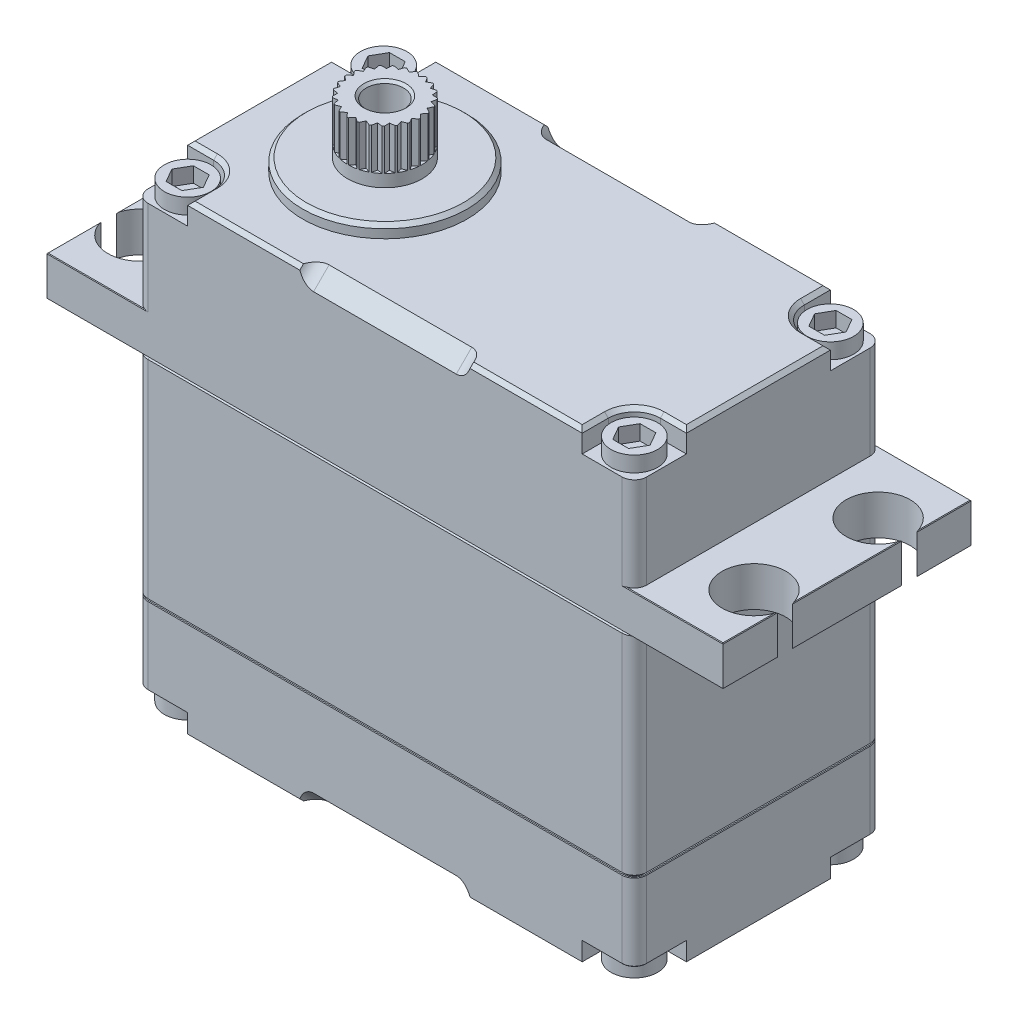
from build123d import *

# Parameters (mm, degrees)
SKETCH1_W              = 40.2
SKETCH1_H              = 20
BOSS_EXTRUDE1_DEPTH    = 9.3
SKETCH2_W              = 54.5
SKETCH2_H              = 20
BOSS_EXTRUDE2_DEPTH    = 3.2
SKETCH3_W              = 40.2
SKETCH3_H              = 20
BOSS_EXTRUDE3_DEPTH    = 17
SKETCH4_W              = 40.2
SKETCH4_H              = 20
BOSS_EXTRUDE5_DEPTH    = 8
SKETCH5_R              = 6.625
BOSS_EXTRUDE6_DEPTH    = 1
SKETCH6_R              = 3
BOSS_EXTRUDE7_DEPTH    = 4.3
SKETCH7_R              = 2.575
CUT_EXTRUDE1_DEPTH     = 3.2
SKETCH9_R              = 1.5
CUT_EXTRUDE3_DEPTH     = 4
CHAMFER1_SIZE          = 0.2
BOSS_EXTRUDE8_START    = -40.2
SKETCH10_W             = 6
SKETCH10_H             = 3
BOSS_EXTRUDE8_DEPTH    = 5
CUT_EXTRUDE2_DEPTH     = 3.3
CUT_EXTRUDE4_DEPTH     = 1.75
CUT_EXTRUDE6_START     = -1.75
CUT_EXTRUDE6_DEPTH     = 1.75
SKETCH12_W             = 14
SKETCH12_H             = 1.25
CUT_EXTRUDE5_DEPTH     = 1.25
SKETCH14_W             = 14
SKETCH14_H             = 1.25
CUT_EXTRUDE7_DEPTH     = 1.25
CHAMFER2_SIZE          = 1.25
CHAMFER3_SIZE          = 1.25
FILLET1_R              = 1.25
CHAMFER5_SIZE          = 0.3
FILLET2_R              = 1.25
CHAMFER6_SIZE          = 0.3
FILLET3_R              = 1
FILLET4_R              = 1
FILLET5_R              = 1
SKETCH15_R             = 1.875
BOSS_EXTRUDE10_DEPTH   = 1.25
BOSS_EXTRUDE10_2_DEPTH = 1.25
BOSS_EXTRUDE10_3_DEPTH = 1.25
BOSS_EXTRUDE10_4_DEPTH = 1.25
SKETCH16_R             = 1.875
BOSS_EXTRUDE12_DEPTH   = 1.25
BOSS_EXTRUDE12_2_DEPTH = 1.25
BOSS_EXTRUDE12_3_DEPTH = 1.25
BOSS_EXTRUDE12_4_DEPTH = 1.25
CHAMFER8_SIZE          = 0.15
CUT_EXTRUDE8_DEPTH     = 1.22
CUT_EXTRUDE9_DEPTH     = 1.22
CHAMFER9_SIZE          = 0.05
CHAMFER10_SIZE         = 0.05


# Some blends are built 0.0001 mm under size
with BuildPart() as part:
    # Sketch1 → Boss-Extrude1 (new body)
    with BuildSketch(Plane(origin=(0, 0, 0), x_dir=(1, 0, 0), z_dir=(0, 1, 0))):
        with Locations((20.1, 10)):
            Rectangle(SKETCH1_W, SKETCH1_H)
    extrude(amount=BOSS_EXTRUDE1_DEPTH)

    # Sketch2 → Boss-Extrude2 (add)
    with BuildSketch(Plane.XZ):
        with Locations((20.1, -10)):
            Rectangle(SKETCH2_W, SKETCH2_H)
    extrude(amount=BOSS_EXTRUDE2_DEPTH)

    # Sketch5 → Boss-Extrude6 (add)
    with BuildSketch(Plane(origin=(0, 9.3, 0), x_dir=(1, 0, 0), z_dir=(0, 1, 0))):
        with Locations(Location((10.1, 10, 0), (0, 0, 90))):
            Circle(SKETCH5_R)
    extrude(amount=BOSS_EXTRUDE6_DEPTH)

    # Sketch7 → Cut-Extrude1 (cut)
    with BuildSketch(Plane(origin=(0, 0, 0), x_dir=(1, 0, 0), z_dir=(0, 1, 0))):
        with Locations((-4.65, 5)):
            Circle(SKETCH7_R)
        with Locations((-4.65, 15)):
            Circle(SKETCH7_R)
        with Locations((44.85, 15)):
            Circle(SKETCH7_R)
        with Locations((44.85, 5)):
            Circle(SKETCH7_R)
    extrude(amount=-CUT_EXTRUDE1_DEPTH, mode=Mode.SUBTRACT)

    # Sketch11 → Cut-Extrude4 (cut)
    with BuildSketch(Plane(origin=(0, 9.3, 0), x_dir=(1, 0, 0), z_dir=(0, 1, 0))):
        with BuildLine():
            Line((36, 2.1), (36, 0))
            Line((36, 0), (40.2, 0))
            Line((40.2, 0), (40.2, 4.2))
            Line((40.2, 4.2), (38.1, 4.2))
            ThreePointArc((38.1, 4.2), (36.61507576, 3.58492424), (36, 2.1))
        make_face()
        with BuildLine():
            Line((38.1, 15.8), (40.2, 15.8))
            Line((40.2, 15.8), (40.2, 20))
            Line((40.2, 20), (36, 20))
            Line((36, 20), (36, 17.9))
            ThreePointArc((36, 17.9), (36.61507576, 16.41507576), (38.1, 15.8))
        make_face()
        with BuildLine():
            Line((2.1, 4.2), (0, 4.2))
            Line((0, 4.2), (0, 0))
            Line((0, 0), (4.2, 0))
            Line((4.2, 0), (4.2, 2.1))
            ThreePointArc((4.2, 2.1), (3.58492424, 3.58492424), (2.1, 4.2))
        make_face()
        with BuildLine():
            Line((4.2, 17.9), (4.2, 20))
            Line((4.2, 20), (0, 20))
            Line((0, 20), (0, 15.8))
            Line((0, 15.8), (2.1, 15.8))
            ThreePointArc((2.1, 15.8), (3.58492424, 16.41507576), (4.2, 17.9))
        make_face()
    extrude(amount=-CUT_EXTRUDE4_DEPTH, mode=Mode.SUBTRACT)

    # Sketch12 → Cut-Extrude5 (cut)
    with BuildSketch(Plane(origin=(0, 9.3, 0), x_dir=(1, 0, 0), z_dir=(0, 1, 0))):
        with Locations((20.1, 19.375)):
            Rectangle(SKETCH12_W, SKETCH12_H)
        with Locations((20.1, 0.625)):
            Rectangle(SKETCH12_W, SKETCH12_H)
    extrude(amount=-CUT_EXTRUDE5_DEPTH, mode=Mode.SUBTRACT)

    # Chamfer2
    chamfer2_edges = [part.edges().sort_by_distance(p)[0] for p in [
        (20.1, 8.05, -1.25),
        (20.1, 8.05, -18.75),
    ]]
    chamfer(chamfer2_edges, length=CHAMFER2_SIZE - 0.0001)  # a hair under: the kernel refuses the full size

    # Fillet1
    # the kernel refuses this fillet: 1.25 mm, written as the material it adds along each edge
    with BuildSketch(Plane(origin=(13.1, 5.840291309, 2.209608691), x_dir=(0, 0.7071067811865475, 0.7071067811865477), z_dir=(0, 0.7071067811865476, -0.7071067811865475))) as fillet1_piece_1_section:
        with BuildLine():
            CenterArc((FILLET1_R, FILLET1_R), FILLET1_R, 180, 90)
            Line((0, FILLET1_R), (-FILLET1_R * 0.02, FILLET1_R))
            Line((-FILLET1_R * 0.02, FILLET1_R), (-FILLET1_R * 0.02, -FILLET1_R * 0.02))
            Line((-FILLET1_R * 0.02, -FILLET1_R * 0.02), (FILLET1_R, -FILLET1_R * 0.02))
            Line((FILLET1_R, -FILLET1_R * 0.02), (FILLET1_R, 0))
        make_face()
    fillet1_piece_1 = extrude(amount=8.017625532, mode=Mode.PRIVATE)
    fillet1_piece_1 = split(fillet1_piece_1, bisect_by=Plane(origin=(13.1, 9.3, 2.209608691), z_dir=(0, -1, 0)), keep=Keep.TOP, mode=Mode.PRIVATE)
    fillet1_piece_1 = split(fillet1_piece_1, bisect_by=Plane(origin=(13.1, 5.840291309, 0), z_dir=(0, 0, -1)), keep=Keep.TOP, mode=Mode.PRIVATE)
    add(fillet1_piece_1)
    with BuildSketch(Plane(origin=(27.1, 5.840291309, 2.209608691), x_dir=(-1, 0, 0), z_dir=(0, 0.7071067811865476, -0.7071067811865475))) as fillet1_piece_2_section:
        with BuildLine():
            CenterArc((FILLET1_R, FILLET1_R), FILLET1_R, 180, 90)
            Line((0, FILLET1_R), (-FILLET1_R * 0.02, FILLET1_R))
            Line((-FILLET1_R * 0.02, FILLET1_R), (-FILLET1_R * 0.02, -FILLET1_R * 0.02))
            Line((-FILLET1_R * 0.02, -FILLET1_R * 0.02), (FILLET1_R, -FILLET1_R * 0.02))
            Line((FILLET1_R, -FILLET1_R * 0.02), (FILLET1_R, 0))
        make_face()
    fillet1_piece_2 = extrude(amount=8.017625532, mode=Mode.PRIVATE)
    fillet1_piece_2 = split(fillet1_piece_2, bisect_by=Plane(origin=(27.1, 9.3, 2.209608691), z_dir=(0, -1, 0)), keep=Keep.TOP, mode=Mode.PRIVATE)
    fillet1_piece_2 = split(fillet1_piece_2, bisect_by=Plane(origin=(27.1, 5.840291309, 0), z_dir=(0, 0, -1)), keep=Keep.TOP, mode=Mode.PRIVATE)
    add(fillet1_piece_2)
    with BuildSketch(Plane(origin=(13.1, 11.509608691, -16.540291309), x_dir=(0, 0.7071067811865476, -0.7071067811865476), z_dir=(-1.0048591735576162e-15, -0.7071067811865476, -0.7071067811865476))) as fillet1_piece_3_section:
        with BuildLine():
            CenterArc((FILLET1_R, FILLET1_R), FILLET1_R, 180, 90)
            Line((0, FILLET1_R), (-FILLET1_R * 0.02, FILLET1_R))
            Line((-FILLET1_R * 0.02, FILLET1_R), (-FILLET1_R * 0.02, -FILLET1_R * 0.02))
            Line((-FILLET1_R * 0.02, -FILLET1_R * 0.02), (FILLET1_R, -FILLET1_R * 0.02))
            Line((FILLET1_R, -FILLET1_R * 0.02), (FILLET1_R, 0))
        make_face()
    fillet1_piece_3 = extrude(amount=8.017625532, mode=Mode.PRIVATE)
    fillet1_piece_3 = split(fillet1_piece_3, bisect_by=Plane(origin=(13.1, 9.3, -16.540291309), z_dir=(0, -1, 0)), keep=Keep.TOP, mode=Mode.PRIVATE)
    fillet1_piece_3 = split(fillet1_piece_3, bisect_by=Plane(origin=(13.1, 11.509608691, -20), z_dir=(0, 0, 1)), keep=Keep.TOP, mode=Mode.PRIVATE)
    add(fillet1_piece_3)
    with BuildSketch(Plane(origin=(27.1, 11.509608691, -16.540291309), x_dir=(0, 0.7071067811865476, -0.7071067811865476), z_dir=(0, -0.7071067811865476, -0.7071067811865476))) as fillet1_piece_4_section:
        with BuildLine():
            CenterArc((FILLET1_R, -FILLET1_R), FILLET1_R, 90, 90)
            Line((0, -FILLET1_R), (-FILLET1_R * 0.02, -FILLET1_R))
            Line((-FILLET1_R * 0.02, -FILLET1_R), (-FILLET1_R * 0.02, FILLET1_R * 0.02))
            Line((-FILLET1_R * 0.02, FILLET1_R * 0.02), (FILLET1_R, FILLET1_R * 0.02))
            Line((FILLET1_R, FILLET1_R * 0.02), (FILLET1_R, 0))
        make_face()
    fillet1_piece_4 = extrude(amount=8.017625532, mode=Mode.PRIVATE)
    fillet1_piece_4 = split(fillet1_piece_4, bisect_by=Plane(origin=(27.1, 9.3, -16.540291309), z_dir=(0, -1, 0)), keep=Keep.TOP, mode=Mode.PRIVATE)
    fillet1_piece_4 = split(fillet1_piece_4, bisect_by=Plane(origin=(27.1, 11.509608691, -20), z_dir=(0, 0, 1)), keep=Keep.TOP, mode=Mode.PRIVATE)
    add(fillet1_piece_4)

    # Chamfer5
    chamfer5_edges = [part.edges().sort_by_distance(p)[0] for p in [
        (31.522601553, 9.3, 0),
        (39.15, 9.3, -4.2),
        (36, 9.3, -1.05),
        (36.61507576, 9.3, -3.58492424),
        (40.2, 9.3, -10),
        (36, 9.3, -18.95),
        (39.15, 9.3, -15.8),
        (36.61507576, 9.3, -16.41507576),
        (31.522601553, 9.3, -20),
        (1.05, 9.3, -15.8),
        (4.2, 9.3, -18.95),
        (3.58492424, 9.3, -16.41507576),
        (8.677398447, 9.3, -20),
        (0, 9.3, -10),
        (4.2, 9.3, -1.05),
        (1.05, 9.3, -4.2),
        (3.58492424, 9.3, -3.58492424),
        (8.677398447, 9.3, 0),
        (10.1, 10.3, -3.375),
    ]]
    chamfer(chamfer5_edges, length=CHAMFER5_SIZE)

    # Fillet5
    fillet5_edges = [part.edges().sort_by_distance(p)[0] for p in [
        (40.2, 3.775, -20),
        (0, 3.775, -20),
        (40.2, 3.775, 0),
        (0, 3.775, 0),
    ]]
    fillet(fillet5_edges, radius=FILLET5_R)

    # Chamfer10
    chamfer10_edges = [part.edges().sort_by_distance(p)[0] for p in [
        (-7.15, 0, -2.191525933),
        (-3.075, 0, -20),
        (43.275, 0, -20),
        (47.35, 0, -17.808474067),
        (43.275, 0, 0),
        (-3.075, 0, 0),
        (-7.15, -3.2, -2.191525933),
        (20.1, -3.2, -20),
        (47.35, -3.2, -17.808474067),
        (20.1, -3.2, 0),
        (47.35, 0, -10),
        (47.35, 0, -2.191525933),
        (-7.15, -3.2, -10),
        (-7.15, -3.2, -17.808474067),
        (47.35, -3.2, -10),
        (47.35, -3.2, -2.191525933),
        (-7.15, 0, -10),
        (-7.15, 0, -17.808474067),
    ]]
    chamfer(chamfer10_edges, length=CHAMFER10_SIZE)


with BuildPart() as body_2:
    # Sketch3 → Boss-Extrude3 (new body)
    with BuildSketch(Plane.XZ.offset(3.2)):
        with Locations((20.1, -10)):
            Rectangle(SKETCH3_W, SKETCH3_H)
    extrude(amount=BOSS_EXTRUDE3_DEPTH)

    # Fillet3
    fillet3_edges = [body_2.edges().sort_by_distance(p)[0] for p in [
        (0, -11.7, -20),
        (0, -11.7, 0),
        (40.2, -11.7, 0),
        (40.2, -11.7, -20),
    ]]
    fillet(fillet3_edges, radius=FILLET3_R)

    # Chamfer8
    chamfer8_edges = [body_2.edges().sort_by_distance(p)[0] for p in [
        (20.1, -3.2, 0),
        (20.1, -20.2, 0),
        (20.1, -3.2, -20),
        (0, -3.2, -10),
        (40.2, -3.2, -10),
        (0.292893219, -3.2, -19.707106781),
        (0.292893219, -3.2, -0.292893219),
        (39.907106781, -3.2, -19.707106781),
        (39.907106781, -3.2, -0.292893219),
        (40.2, -20.2, -10),
        (20.1, -20.2, -20),
        (0, -20.2, -10),
        (0.292893219, -20.2, -19.707106781),
        (0.292893219, -20.2, -0.292893219),
        (39.907106781, -20.2, -19.707106781),
        (39.907106781, -20.2, -0.292893219),
    ]]
    chamfer(chamfer8_edges, length=CHAMFER8_SIZE)


with BuildPart() as body_3:
    # Sketch4 → Boss-Extrude5 (new body)
    with BuildSketch(Plane.XZ.offset(20.2)):
        with Locations((20.1, -10)):
            Rectangle(SKETCH4_W, SKETCH4_H)
    extrude(amount=BOSS_EXTRUDE5_DEPTH)

    # Sketch13 → Cut-Extrude6 (cut)
    with BuildSketch(Plane.XZ.offset(28.2).offset(CUT_EXTRUDE6_START)):
        with BuildLine():
            Line((38.1, -15.8), (40.2, -15.8))
            Line((40.2, -15.8), (40.2, -20))
            Line((40.2, -20), (36, -20))
            Line((36, -20), (36, -17.9))
            ThreePointArc((36, -17.9), (36.61507576, -16.41507576), (38.1, -15.8))
        make_face()
        with BuildLine():
            Line((36, -2.1), (36, 0))
            Line((36, 0), (40.2, 0))
            Line((40.2, 0), (40.2, -4.2))
            Line((40.2, -4.2), (38.1, -4.2))
            ThreePointArc((38.1, -4.2), (36.61507576, -3.58492424), (36, -2.1))
        make_face()
        with BuildLine():
            Line((2.1, -4.2), (0, -4.2))
            Line((0, -4.2), (0, 0))
            Line((0, 0), (4.2, 0))
            Line((4.2, 0), (4.2, -2.1))
            ThreePointArc((4.2, -2.1), (3.58492424, -3.58492424), (2.1, -4.2))
        make_face()
        with BuildLine():
            Line((4.2, -17.9), (4.2, -20))
            Line((4.2, -20), (0, -20))
            Line((0, -20), (0, -15.8))
            Line((0, -15.8), (2.1, -15.8))
            ThreePointArc((2.1, -15.8), (3.58492424, -16.41507576), (4.2, -17.9))
        make_face()
    extrude(amount=CUT_EXTRUDE6_DEPTH, mode=Mode.SUBTRACT)

    # Sketch14 → Cut-Extrude7 (cut)
    with BuildSketch(Plane.XZ.offset(28.2)):
        with Locations((20.1, -19.375)):
            Rectangle(SKETCH14_W, SKETCH14_H)
        with Locations((20.1, -0.625)):
            Rectangle(SKETCH14_W, SKETCH14_H)
    extrude(amount=-CUT_EXTRUDE7_DEPTH, mode=Mode.SUBTRACT)

    # Chamfer3
    chamfer3_edges = [body_3.edges().sort_by_distance(p)[0] for p in [
        (20.1, -26.95, -1.25),
        (20.1, -26.95, -18.75),
    ]]
    chamfer(chamfer3_edges, length=CHAMFER3_SIZE - 0.0001)  # a hair under: the kernel refuses the full size

    # Fillet2
    # the kernel refuses this fillet: 1.25 mm, written as the material it adds along each edge
    with BuildSketch(Plane(origin=(13.1, -24.740291309, -22.209608691), x_dir=(1, 0, 0), z_dir=(1.0048591735576162e-15, -0.7071067811865476, 0.7071067811865476))) as fillet2_piece_1_section:
        with BuildLine():
            CenterArc((FILLET2_R, -FILLET2_R), FILLET2_R, 90, 90)
            Line((0, -FILLET2_R), (-FILLET2_R * 0.02, -FILLET2_R))
            Line((-FILLET2_R * 0.02, -FILLET2_R), (-FILLET2_R * 0.02, FILLET2_R * 0.02))
            Line((-FILLET2_R * 0.02, FILLET2_R * 0.02), (FILLET2_R, FILLET2_R * 0.02))
            Line((FILLET2_R, FILLET2_R * 0.02), (FILLET2_R, 0))
        make_face()
    fillet2_piece_1 = extrude(amount=8.017625532, mode=Mode.PRIVATE)
    fillet2_piece_1 = split(fillet2_piece_1, bisect_by=Plane(origin=(13.1, -28.2, -22.209608691), z_dir=(0, 1, 0)), keep=Keep.TOP, mode=Mode.PRIVATE)
    fillet2_piece_1 = split(fillet2_piece_1, bisect_by=Plane(origin=(13.1, -24.740291309, -20), z_dir=(0, 0, 1)), keep=Keep.TOP, mode=Mode.PRIVATE)
    add(fillet2_piece_1)
    with BuildSketch(Plane(origin=(27.1, -24.740291309, -22.209608691), x_dir=(-2.842170943040401e-15, -0.7071067811865476, -0.7071067811865476), z_dir=(0, -0.7071067811865476, 0.7071067811865476))) as fillet2_piece_2_section:
        with BuildLine():
            CenterArc((FILLET2_R, -FILLET2_R), FILLET2_R, 90, 90)
            Line((0, -FILLET2_R), (-FILLET2_R * 0.02, -FILLET2_R))
            Line((-FILLET2_R * 0.02, -FILLET2_R), (-FILLET2_R * 0.02, FILLET2_R * 0.02))
            Line((-FILLET2_R * 0.02, FILLET2_R * 0.02), (FILLET2_R, FILLET2_R * 0.02))
            Line((FILLET2_R, FILLET2_R * 0.02), (FILLET2_R, 0))
        make_face()
    fillet2_piece_2 = extrude(amount=8.017625532, mode=Mode.PRIVATE)
    fillet2_piece_2 = split(fillet2_piece_2, bisect_by=Plane(origin=(27.1, -28.2, -22.209608691), z_dir=(0, 1, 0)), keep=Keep.TOP, mode=Mode.PRIVATE)
    fillet2_piece_2 = split(fillet2_piece_2, bisect_by=Plane(origin=(27.1, -24.740291309, -20), z_dir=(0, 0, 1)), keep=Keep.TOP, mode=Mode.PRIVATE)
    add(fillet2_piece_2)
    with BuildSketch(Plane(origin=(27.1, -30.409608691, -3.459708691), x_dir=(0, -0.7071067811865475, 0.7071067811865477), z_dir=(0, 0.7071067811865476, 0.7071067811865475))) as fillet2_piece_3_section:
        with BuildLine():
            CenterArc((FILLET2_R, -FILLET2_R), FILLET2_R, 90, 90)
            Line((0, -FILLET2_R), (-FILLET2_R * 0.02, -FILLET2_R))
            Line((-FILLET2_R * 0.02, -FILLET2_R), (-FILLET2_R * 0.02, FILLET2_R * 0.02))
            Line((-FILLET2_R * 0.02, FILLET2_R * 0.02), (FILLET2_R, FILLET2_R * 0.02))
            Line((FILLET2_R, FILLET2_R * 0.02), (FILLET2_R, 0))
        make_face()
    fillet2_piece_3 = extrude(amount=8.017625532, mode=Mode.PRIVATE)
    fillet2_piece_3 = split(fillet2_piece_3, bisect_by=Plane(origin=(27.1, -28.2, -3.459708691), z_dir=(0, 1, 0)), keep=Keep.TOP, mode=Mode.PRIVATE)
    fillet2_piece_3 = split(fillet2_piece_3, bisect_by=Plane(origin=(27.1, -30.409608691, 0), z_dir=(0, 0, -1)), keep=Keep.TOP, mode=Mode.PRIVATE)
    add(fillet2_piece_3)
    with BuildSketch(Plane(origin=(13.1, -30.409608691, -3.459708691), x_dir=(0, -0.7071067811865475, 0.7071067811865476), z_dir=(0, 0.7071067811865476, 0.7071067811865475))) as fillet2_piece_4_section:
        with BuildLine():
            CenterArc((FILLET2_R, FILLET2_R), FILLET2_R, 180, 90)
            Line((0, FILLET2_R), (-FILLET2_R * 0.02, FILLET2_R))
            Line((-FILLET2_R * 0.02, FILLET2_R), (-FILLET2_R * 0.02, -FILLET2_R * 0.02))
            Line((-FILLET2_R * 0.02, -FILLET2_R * 0.02), (FILLET2_R, -FILLET2_R * 0.02))
            Line((FILLET2_R, -FILLET2_R * 0.02), (FILLET2_R, 0))
        make_face()
    fillet2_piece_4 = extrude(amount=8.017625532, mode=Mode.PRIVATE)
    fillet2_piece_4 = split(fillet2_piece_4, bisect_by=Plane(origin=(13.1, -28.2, -3.459708691), z_dir=(0, 1, 0)), keep=Keep.TOP, mode=Mode.PRIVATE)
    fillet2_piece_4 = split(fillet2_piece_4, bisect_by=Plane(origin=(13.1, -30.409608691, 0), z_dir=(0, 0, -1)), keep=Keep.TOP, mode=Mode.PRIVATE)
    add(fillet2_piece_4)

    # Chamfer6
    chamfer6_edges = [body_3.edges().sort_by_distance(p)[0] for p in [
        (40.2, -28.2, -10),
        (36, -28.2, -1.05),
        (39.15, -28.2, -4.2),
        (36.61507576, -28.2, -3.58492424),
        (31.522601553, -28.2, 0),
        (39.15, -28.2, -15.8),
        (36.61507576, -28.2, -16.41507576),
        (36, -28.2, -18.95),
        (31.522601553, -28.2, -20),
        (8.677398447, -28.2, -20),
        (4.2, -28.2, -18.95),
        (3.58492424, -28.2, -16.41507576),
        (1.05, -28.2, -15.8),
        (0, -28.2, -10),
        (1.05, -28.2, -4.2),
        (3.58492424, -28.2, -3.58492424),
        (4.2, -28.2, -1.05),
        (8.677398447, -28.2, 0),
    ]]
    chamfer(chamfer6_edges, length=CHAMFER6_SIZE)

    # Fillet4
    fillet4_edges = [body_3.edges().sort_by_distance(p)[0] for p in [
        (0, -23.325, 0),
        (40.2, -23.325, 0),
        (40.2, -23.325, -20),
        (0, -23.325, -20),
    ]]
    fillet(fillet4_edges, radius=FILLET4_R)

    # Chamfer9
    chamfer9_edges = [body_3.edges().sort_by_distance(p)[0] for p in [
        (0, -26.45, -2.6),
        (0, -20.2, -10),
        (20.1, -20.2, 0),
        (40.2, -20.2, -10),
        (20.1, -20.2, -20),
        (0.292893219, -20.2, -19.707106781),
        (39.907106781, -20.2, -19.707106781),
        (39.907106781, -20.2, -0.292893219),
        (0.292893219, -20.2, -0.292893219),
        (37.6, -26.45, 0),
        (0.292893219, -26.45, -0.292893219),
        (40.2, -26.45, -17.4),
        (39.907106781, -26.45, -0.292893219),
        (2.6, -26.45, -20),
        (39.907106781, -26.45, -19.707106781),
        (0.292893219, -26.45, -19.707106781),
        (0, -26.45, -17.4),
        (2.6, -26.45, 0),
        (40.2, -26.45, -2.6),
        (37.6, -26.45, -20),
    ]]
    chamfer(chamfer9_edges, length=CHAMFER9_SIZE)


with BuildPart() as body_4:
    # Sketch6 → Boss-Extrude7 (new body)
    with BuildSketch(Plane(origin=(0, 10.3, 0), x_dir=(1, 0, 0), z_dir=(0, 1, 0))):
        with Locations(Location((10.1, 10, 0), (0, 0, 90))):
            Circle(SKETCH6_R)
    extrude(amount=BOSS_EXTRUDE7_DEPTH)

    # Sketch9 → Cut-Extrude3 (cut)
    with BuildSketch(Plane(origin=(0, 14.6, 0), x_dir=(1, 0, 0), z_dir=(0, 1, 0))):
        with Locations(Location((10.1, 10, 0), (0, 0, 270))):
            Circle(SKETCH9_R)
    extrude(amount=-CUT_EXTRUDE3_DEPTH, mode=Mode.SUBTRACT)

    # Chamfer1
    chamfer1_edges = [body_4.edges().sort_by_distance(p)[0] for p in [
        (10.1, 14.6, -11.5),
    ]]
    chamfer(chamfer1_edges, length=CHAMFER1_SIZE)

    # Sketch8 → Cut-Extrude2 (cut)
    with BuildSketch(Plane(origin=(0, 14.6, 0), x_dir=(1, 0, 0), z_dir=(0, 1, 0))):
        Polygon((9.775, 13), (10.425, 13), (10.1, 12.7), align=None)
        Polygon((10.771462695, 12.615174535), (10.531280134, 12.986573697), (11.160859189, 12.82492527), align=None)
        Polygon((11.40073492, 12.366028036), (11.260461351, 12.785489984), (11.830060693, 12.472350096), align=None)
        Polygon((11.948277186, 11.968215294), (11.916726514, 12.409383692), (12.390556122, 11.964428073), align=None)
        Polygon((12.379685399, 11.446732346), (12.458840068, 11.881886961), (12.807127485, 11.333073809), align=None)
        Polygon((12.667852594, 10.834345885), (12.852739026, 11.236144351), (13.053600072, 10.617957615), align=None)
        Polygon((12.794672167, 10.169534403), (13.073673266, 10.512730245), (13.114487104, 9.864012872), align=None)
        Polygon((12.752175577, 9.494070451), (13.107760679, 9.757099413), (12.985962825, 9.1186127), align=None)
        Polygon((12.543033042, 8.850395913), (12.952859427, 9.016730917), (12.676102888, 8.428593333), align=None)
        Polygon((12.180385755, 8.278955228), (12.618702525, 8.338144835), (12.204376932, 7.837311227), align=None)
        Polygon((11.687020181, 7.815654115), (12.12628628, 7.763979224), (11.600425234, 7.38191881), align=None)
        Polygon((11.093936292, 7.489603488), (11.506551016, 7.330311022), (10.9021963, 7.091030063), align=None)
        Polygon((10.438399731, 7.321290306), (10.798436979, 7.064389197), (10.153562423, 6.982922595), align=None)
        Polygon((9.761600269, 7.321290306), (10.046437577, 6.982922595), (9.401563021, 7.064389197), align=None)
        Polygon((9.106063708, 7.489603488), (9.2978037, 7.091030063), (8.693448984, 7.330311022), align=None)
        Polygon((8.512979819, 7.815654115), (8.599574766, 7.38191881), (8.07371372, 7.763979224), align=None)
        Polygon((8.019614245, 8.278955228), (7.995623068, 7.837311227), (7.581297475, 8.338144835), align=None)
        Polygon((7.656966958, 8.850395913), (7.523897112, 8.428593333), (7.247140573, 9.016730917), align=None)
        Polygon((7.447824423, 9.494070451), (7.214037175, 9.1186127), (7.092239321, 9.757099413), align=None)
        Polygon((7.405327833, 10.169534403), (7.085512896, 9.864012872), (7.126326734, 10.512730245), align=None)
        Polygon((7.532147406, 10.834345885), (7.146399928, 10.617957615), (7.347260974, 11.236144351), align=None)
        Polygon((7.820314601, 11.446732346), (7.392872515, 11.333073809), (7.741159932, 11.881886961), align=None)
        Polygon((8.251722814, 11.968215294), (7.809443878, 11.964428073), (8.283273486, 12.409383692), align=None)
        Polygon((8.79926508, 12.366028036), (8.369939307, 12.472350096), (8.939538649, 12.785489984), align=None)
        Polygon((9.428537305, 12.615174535), (9.039140811, 12.82492527), (9.668719866, 12.986573697), align=None)
    extrude(amount=-CUT_EXTRUDE2_DEPTH, mode=Mode.SUBTRACT)


with BuildPart() as body_5:
    # Sketch10 → Boss-Extrude8 (new body)
    with BuildSketch(Plane(origin=(40.2, 0, 0), x_dir=(0, 0, -1), z_dir=(1, 0, 0)).offset(BOSS_EXTRUDE8_START)):
        with Locations((10, -21.7)):
            Rectangle(SKETCH10_W, SKETCH10_H)
    extrude(amount=-BOSS_EXTRUDE8_DEPTH)


with BuildPart() as body_6:
    # Sketch15 → Boss-Extrude10 (new body)
    with BuildSketch(Plane(origin=(0, 7.55, 0), x_dir=(1, 0, 0), z_dir=(0, 1, 0))):
        with Locations(Location((2.1, 2.1, 0), (0, 0, 270))):
            Circle(SKETCH15_R)
    extrude(amount=BOSS_EXTRUDE10_DEPTH)


with BuildPart() as body_7:
    # Sketch15 → Boss-Extrude10 2 (new body)
    with BuildSketch(Plane(origin=(0, 7.55, 0), x_dir=(1, 0, 0), z_dir=(0, 1, 0))):
        with Locations(Location((2.1, 17.9, 0), (0, 0, 270))):
            Circle(SKETCH15_R)
    extrude(amount=BOSS_EXTRUDE10_2_DEPTH)


with BuildPart() as body_8:
    # Sketch15 → Boss-Extrude10 3 (new body)
    with BuildSketch(Plane(origin=(0, 7.55, 0), x_dir=(1, 0, 0), z_dir=(0, 1, 0))):
        with Locations(Location((38.1, 17.9, 0), (0, 0, 270))):
            Circle(SKETCH15_R)
    extrude(amount=BOSS_EXTRUDE10_3_DEPTH)


with BuildPart() as body_9:
    # Sketch15 → Boss-Extrude10 4 (new body)
    with BuildSketch(Plane(origin=(0, 7.55, 0), x_dir=(1, 0, 0), z_dir=(0, 1, 0))):
        with Locations(Location((38.1, 2.1, 0), (0, 0, 270))):
            Circle(SKETCH15_R)
    extrude(amount=BOSS_EXTRUDE10_4_DEPTH)


with BuildPart() as body_10:
    # Sketch16 → Boss-Extrude12 (new body)
    with BuildSketch(Plane.XZ.offset(26.45)):
        with Locations(Location((2.1, -2.1, 0), (0, 0, 270))):
            Circle(SKETCH16_R)
    extrude(amount=BOSS_EXTRUDE12_DEPTH)


with BuildPart() as body_11:
    # Sketch16 → Boss-Extrude12 2 (new body)
    with BuildSketch(Plane.XZ.offset(26.45)):
        with Locations(Location((38.1, -2.1, 0), (0, 0, 270))):
            Circle(SKETCH16_R)
    extrude(amount=BOSS_EXTRUDE12_2_DEPTH)


with BuildPart() as body_12:
    # Sketch16 → Boss-Extrude12 3 (new body)
    with BuildSketch(Plane.XZ.offset(26.45)):
        with Locations(Location((38.1, -17.9, 0), (0, 0, 270))):
            Circle(SKETCH16_R)
    extrude(amount=BOSS_EXTRUDE12_3_DEPTH)


with BuildPart() as body_13:
    # Sketch16 → Boss-Extrude12 4 (new body)
    with BuildSketch(Plane.XZ.offset(26.45)):
        with Locations(Location((2.1, -17.9, 0), (0, 0, 270))):
            Circle(SKETCH16_R)
    extrude(amount=BOSS_EXTRUDE12_4_DEPTH)


with BuildPart() as cut_extrude8_tool:
    # Sketch18 → Cut-Extrude8 (new body)
    with BuildSketch(Plane(origin=(0, 8.8, 0), x_dir=(1, 0, 0), z_dir=(0, 1, 0))):
        Polygon((2.735085296, 3.2), (3.370170592, 2.1), (2.735085296, 1), (1.464914704, 1), (0.829829408, 2.1), (1.464914704, 3.2), align=None)
        Polygon((3.370170592, 17.9), (2.735085296, 19), (1.464914704, 19), (0.829829408, 17.9), (1.464914704, 16.8), (2.735085296, 16.8), align=None)
        Polygon((38.735085296, 3.2), (37.464914704, 3.2), (36.829829408, 2.1), (37.464914704, 1), (38.735085296, 1), (39.370170592, 2.1), align=None)
        Polygon((37.464914704, 16.8), (36.829829408, 17.9), (37.464914704, 19), (38.735085296, 19), (39.370170592, 17.9), (38.735085296, 16.8), align=None)
    extrude(amount=-CUT_EXTRUDE8_DEPTH)


with BuildPart() as body_6_1:
    add(body_6.part)

    # Cut-Extrude8: cut by cut_extrude8_tool
    add(cut_extrude8_tool.part, mode=Mode.SUBTRACT)


with BuildPart() as body_7_1:
    add(body_7.part)

    # Cut-Extrude8: cut by cut_extrude8_tool
    add(cut_extrude8_tool.part, mode=Mode.SUBTRACT)


with BuildPart() as body_8_1:
    add(body_8.part)

    # Cut-Extrude8: cut by cut_extrude8_tool
    add(cut_extrude8_tool.part, mode=Mode.SUBTRACT)


with BuildPart() as body_9_1:
    add(body_9.part)

    # Cut-Extrude8: cut by cut_extrude8_tool
    add(cut_extrude8_tool.part, mode=Mode.SUBTRACT)


with BuildPart() as cut_extrude9_tool:
    # Sketch19 → Cut-Extrude9 (new body)
    with BuildSketch(Plane.XZ.offset(27.7)):
        Polygon((37.464914704, -16.8), (38.735085296, -16.8), (39.370170592, -17.9), (38.735085296, -19), (37.464914704, -19), (36.829829408, -17.9), align=None)
        Polygon((39.370170592, -2.1), (38.735085296, -3.2), (37.464914704, -3.2), (36.829829408, -2.1), (37.464914704, -1), (38.735085296, -1), align=None)
        Polygon((2.735085296, -3.2), (1.464914704, -3.2), (0.829829408, -2.1), (1.464914704, -1), (2.735085296, -1), (3.370170592, -2.1), align=None)
        Polygon((2.735085296, -16.8), (3.370170592, -17.9), (2.735085296, -19), (1.464914704, -19), (0.829829408, -17.9), (1.464914704, -16.8), align=None)
    extrude(amount=-CUT_EXTRUDE9_DEPTH)


with BuildPart() as body_10_1:
    add(body_10.part)

    # Cut-Extrude9: cut by cut_extrude9_tool
    add(cut_extrude9_tool.part, mode=Mode.SUBTRACT)


with BuildPart() as body_11_1:
    add(body_11.part)

    # Cut-Extrude9: cut by cut_extrude9_tool
    add(cut_extrude9_tool.part, mode=Mode.SUBTRACT)


with BuildPart() as body_12_1:
    add(body_12.part)

    # Cut-Extrude9: cut by cut_extrude9_tool
    add(cut_extrude9_tool.part, mode=Mode.SUBTRACT)


with BuildPart() as body_13_1:
    add(body_13.part)

    # Cut-Extrude9: cut by cut_extrude9_tool
    add(cut_extrude9_tool.part, mode=Mode.SUBTRACT)


solid = Compound([part.part, body_2.part, body_3.part, body_4.part, body_5.part, body_6_1.part, body_7_1.part, body_8_1.part, body_9_1.part, body_10_1.part, body_11_1.part, body_12_1.part, body_13_1.part])
